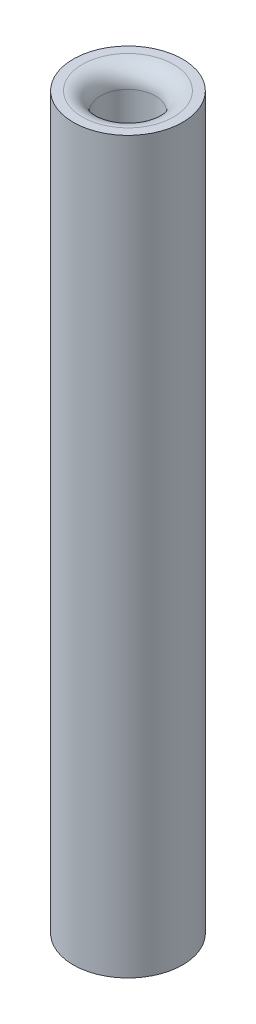
from build123d import *

# Parameters (mm, degrees)
SKETCH2_R           = 3
SKETCH2_R_2         = 1.5
BOSS_EXTRUDE1_DEPTH = 40
FILLET1_R           = 1


with BuildPart() as part:
    # Sketch2 → Boss-Extrude1 (new body)
    with BuildSketch(Plane(origin=(0, 0, 0), x_dir=(1, 0, 0), z_dir=(0, 1, 0))):
        with Locations((-15.084082691, 6.46581124)):
            Circle(SKETCH2_R)
        with Locations((-15.084082691, 6.46581124)):
            Circle(SKETCH2_R_2, mode=Mode.SUBTRACT)
    extrude(amount=BOSS_EXTRUDE1_DEPTH)

    # Fillet1
    fillet1_edges = [part.edges().sort_by_distance(p)[0] for p in [
        (-16.584082691, 0, -6.46581124),
        (-16.584082691, 40, -6.46581124),
    ]]
    fillet(fillet1_edges, radius=FILLET1_R)


solid = part.part
